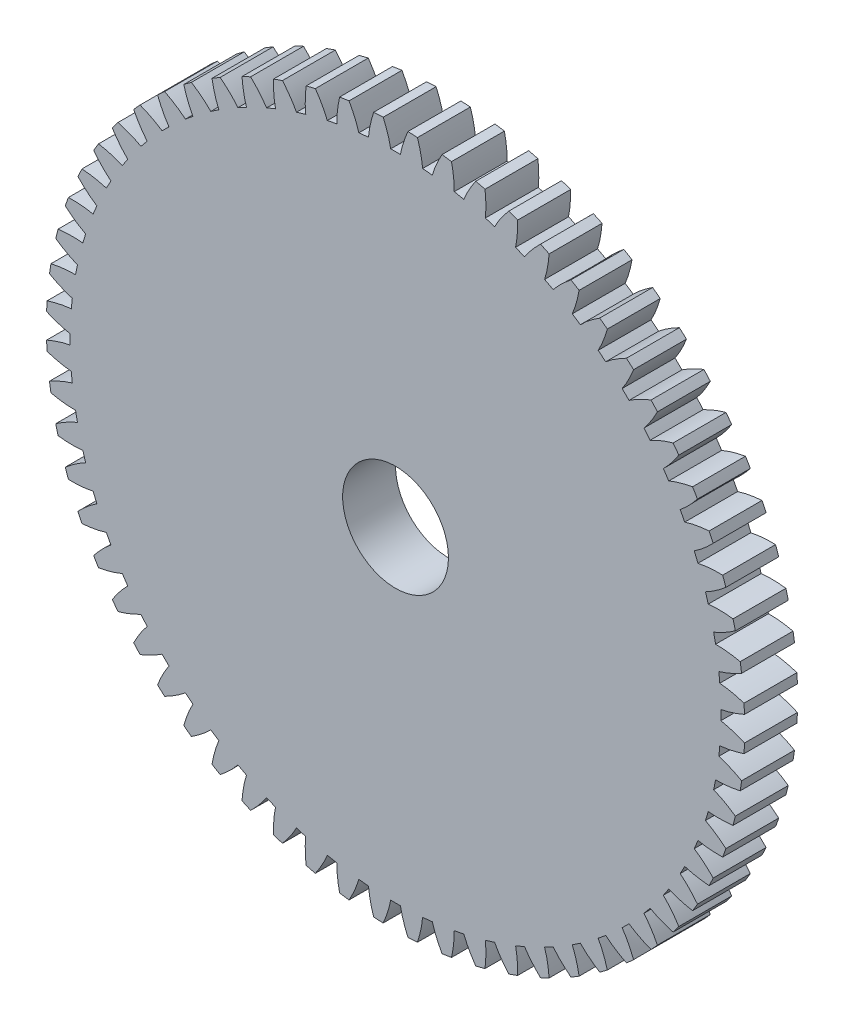
from build123d import *

# Parameters (mm, degrees)
SKETCH_1_R               = 6.6
SKETCH_1_R_2             = 1
EXTRUDE_1_DEPTH          = 1
CUT_EXTRUDE_1_DEPTH      = 10.387225362
PATTERN_CIRCULAR_1_COUNT = 64
PATTERN_CIRCULAR_1_ANGLE = 354.375


with BuildPart() as part:
    # 草图1 → 凸台-拉伸1 (new body)
    with BuildSketch(Plane.XY):
        Circle(SKETCH_1_R)
        Circle(SKETCH_1_R_2, mode=Mode.SUBTRACT)
    extrude(amount=EXTRUDE_1_DEPTH)

    # 草图1<3> → 切除-拉伸1 (cut, through all)
    with BuildSketch(Plane.XY):
        with BuildLine():
            add(Edge.make_bspline(
                [(6.149316256, 0.091703759), (6.160699207, 0.093746308), (6.253160893, 0.111487538), (6.366444793, 0.143328207), (6.477027458, 0.183168674), (6.574510334, 0.224407224), (6.595860055, 0.233730909)],
                knots=[0.004187559, 0.004187559, 0.004187559, 0.004187559, 0.004187559, 0.005604068, 0.015718248, 0.018572792, 0.018572792, 0.018572792, 0.018572792, 0.018572792], degree=4))
            ThreePointArc((6.149316256, 0.091703759), (6.149829062, 0.045853154), (6.15, 0))
            ThreePointArc((6.15, 0), (6.149829062, -0.045853154), (6.149316256, -0.091703759))
            add(Edge.make_bspline(
                [(6.149316256, -0.091703759), (6.160699207, -0.093746308), (6.253160893, -0.111487538), (6.366444793, -0.143328207), (6.477027458, -0.183168674), (6.574510334, -0.224407224), (6.595860055, -0.233730909)],
                knots=[0.004187559, 0.004187559, 0.004187559, 0.004187559, 0.004187559, 0.005604068, 0.015718248, 0.018572792, 0.018572792, 0.018572792, 0.018572792, 0.018572792], degree=4))
            ThreePointArc((6.595860055, -0.233730909), (6.598964933, -0.116883785), (6.6, 0))
            ThreePointArc((6.6, 0), (6.598964933, 0.116883785), (6.595860055, 0.233730909))
        make_face()
    cut_extrude_1 = extrude(amount=CUT_EXTRUDE_1_DEPTH, mode=Mode.SUBTRACT)

    # 阵列(圆周)1: 切除-拉伸1 ×64 about axis
    pattern_circular_1_axis = Axis((0, 0, 1), (0, 0, 1))
    for i in range(1, PATTERN_CIRCULAR_1_COUNT):
        add(cut_extrude_1.rotate(pattern_circular_1_axis, i * PATTERN_CIRCULAR_1_ANGLE / (PATTERN_CIRCULAR_1_COUNT - 1)), mode=Mode.SUBTRACT)


solid = part.part
